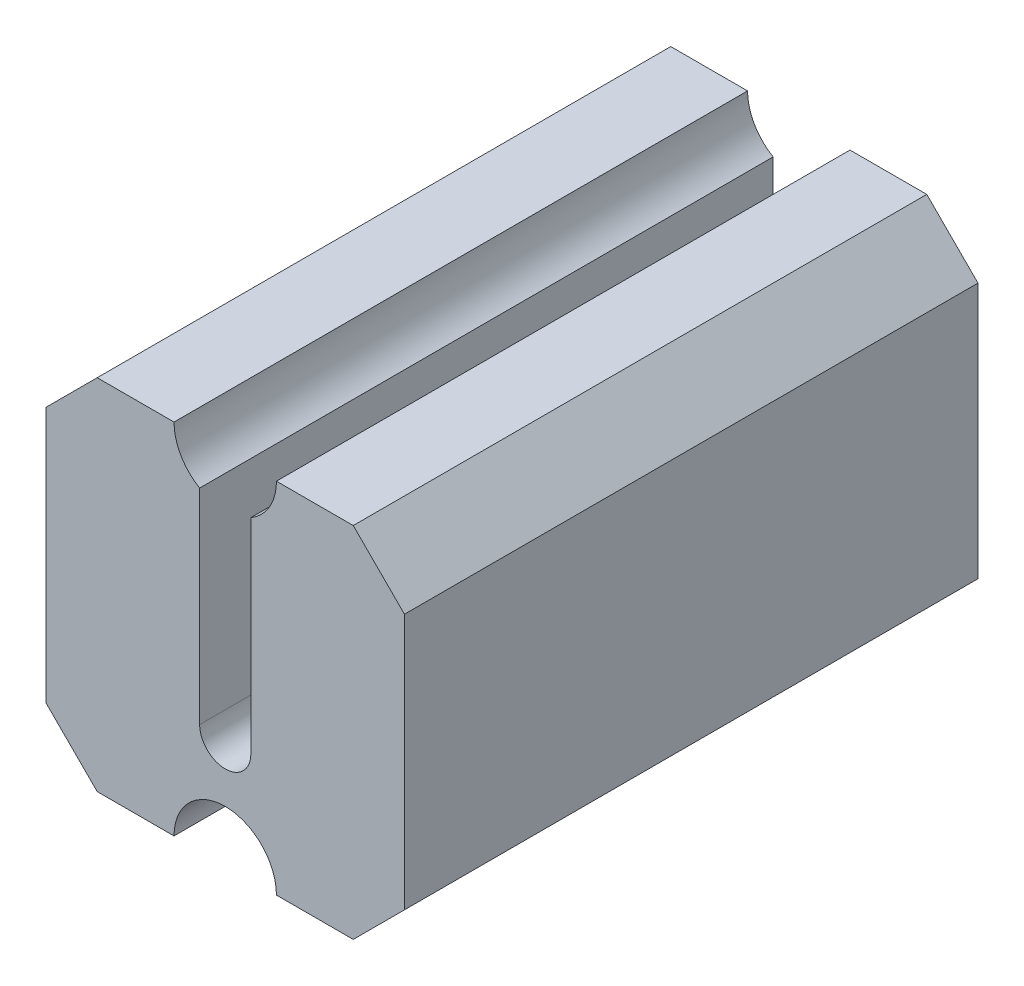
from build123d import *

# Parameters (mm, degrees)
BOSS_EXTRUDE1_DEPTH      = 360
BOSS_EXTRUDE1_DEPTH_BACK = 200


with BuildPart() as part:
    # Sketch1 → Boss-Extrude1 (new, two sides: drawn at the far end of the back side and taken through both)
    with BuildSketch(Plane.XY.offset(-BOSS_EXTRUDE1_DEPTH_BACK)):
        with BuildLine():
            Line((125, 175), (50, 175))
            ThreePointArc((50, 175), (43.301270189, 150), (25, 131.698729811))
            Line((25, 131.698729811), (25, -68.301270189))
            ThreePointArc((25, -68.301270189), (0, -93.301270189), (-25, -68.301270189))
            Line((-25, -68.301270189), (-25, 131.698729811))
            ThreePointArc((-25, 131.698729811), (-43.301270189, 150), (-50, 175))
            Line((-50, 175), (-125, 175))
            Line((-125, 175), (-175, 125))
            Line((-175, 125), (-175, -125))
            Line((-175, -125), (-125, -175))
            Line((-125, -175), (-50, -175))
            ThreePointArc((-50, -175), (0, -125), (50, -175))
            Line((50, -175), (125, -175))
            Line((125, -175), (175, -125))
            Line((175, -125), (175, 125))
            Line((175, 125), (125, 175))
        make_face()
    extrude(amount=BOSS_EXTRUDE1_DEPTH + BOSS_EXTRUDE1_DEPTH_BACK)


solid = part.part
